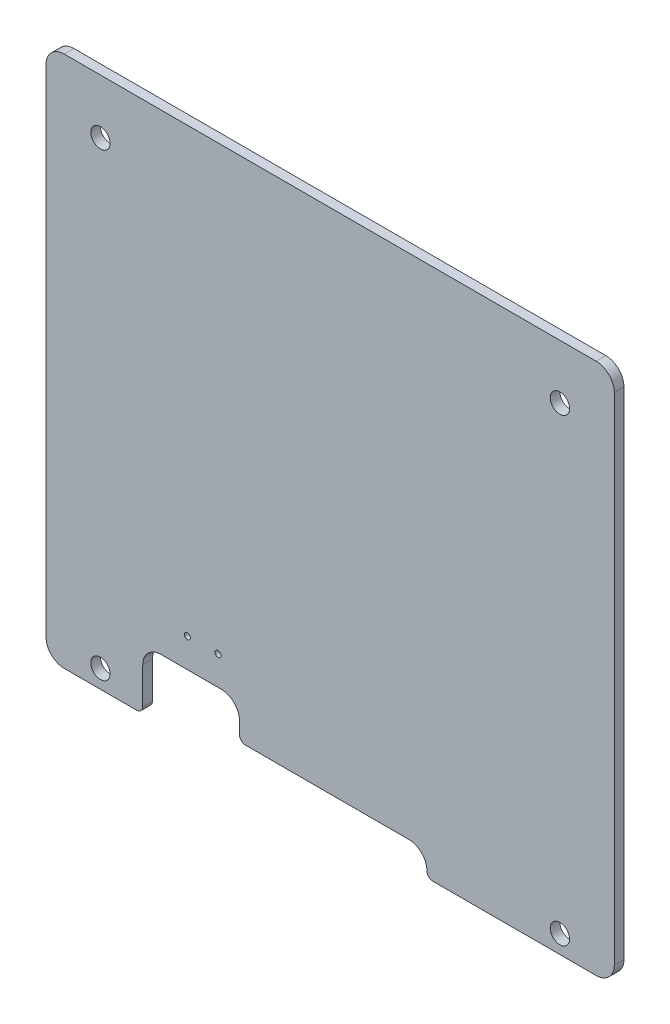
from build123d import *

# Parameters (mm, degrees)
SKETCH1_R                  = 0.5
BOSS_EXTRUDE1_DEPTH        = 1.6
F_3_2_3_2_DIAMETER_HOLE3_D = 3.2
FILLET1_R                  = 3
FILLET2_R                  = 1


with BuildPart() as part:
    # Sketch1 → Boss-Extrude1 (new body)
    with BuildSketch(Plane.XY):
        with BuildLine():
            Line((-55.56534388, 7.95185693), (-55.56534388, 13.95185693))
            Line((-55.56534388, 13.95185693), (-71.56534388, 13.95185693))
            Line((-71.56534388, 13.95185693), (-71.56534388, 3.95185693))
            Line((-71.56534388, 3.95185693), (-84.56534388, 3.95185693))
            ThreePointArc((-84.56534388, 3.95185693), (-86.686664224, 4.830536587), (-87.56534388, 6.95185693))
            Line((-87.56534388, 6.95185693), (-87.56534388, 88.95185693))
            ThreePointArc((-87.56534388, 88.95185693), (-86.686664224, 91.073177274), (-84.56534388, 91.95185693))
            Line((-84.56534388, 91.95185693), (3.43465612, 91.95185693))
            ThreePointArc((3.43465612, 91.95185693), (5.555976464, 91.073177274), (6.43465612, 88.95185693))
            Line((6.43465612, 88.95185693), (6.43465612, 6.95185693))
            ThreePointArc((6.43465612, 6.95185693), (5.555976464, 4.830536587), (3.43465612, 3.95185693))
            Line((3.43465612, 3.95185693), (-24.56534388, 3.95185693))
            Line((-24.56534388, 3.95185693), (-24.56534388, 7.95185693))
            Line((-24.56534388, 7.95185693), (-55.56534388, 7.95185693))
        make_face()
        with Locations((-59.10534388, 18.75185693)):
            Circle(SKETCH1_R, mode=Mode.SUBTRACT)
        with Locations((-64.18534388, 18.75185693)):
            Circle(SKETCH1_R, mode=Mode.SUBTRACT)
    extrude(amount=BOSS_EXTRUDE1_DEPTH)

    # Ø3.2 (3.2) Diameter Hole3 (through all)
    with Locations(Plane(origin=(0, 0, 0), x_dir=(-1, 0, 0), z_dir=(0, 0, -1))):
        with Locations((78.56534388, 6.95185693), (78.56534388, 82.95185693), (2.56534388, 82.95185693), (2.56534388, 6.95185693)):
            Hole(F_3_2_3_2_DIAMETER_HOLE3_D / 2)

    # Fillet1
    fillet1_edges = [part.edges().sort_by_distance(p)[0] for p in [
        (-24.56534388, 7.95185693, 0.8),
        (-55.56534388, 13.95185693, 0.8),
        (-71.56534388, 13.95185693, 0.8),
    ]]
    fillet(fillet1_edges, radius=FILLET1_R)

    # Fillet2
    fillet2_edges = [part.edges().sort_by_distance(p)[0] for p in [
        (-24.56534388, 3.95185693, 0.8),
        (-71.56534388, 3.95185693, 0.8),
        (-55.56534388, 7.95185693, 0.8),
    ]]
    fillet(fillet2_edges, radius=FILLET2_R - 0.0001)  # a hair under: the kernel refuses the full size


solid = part.part
